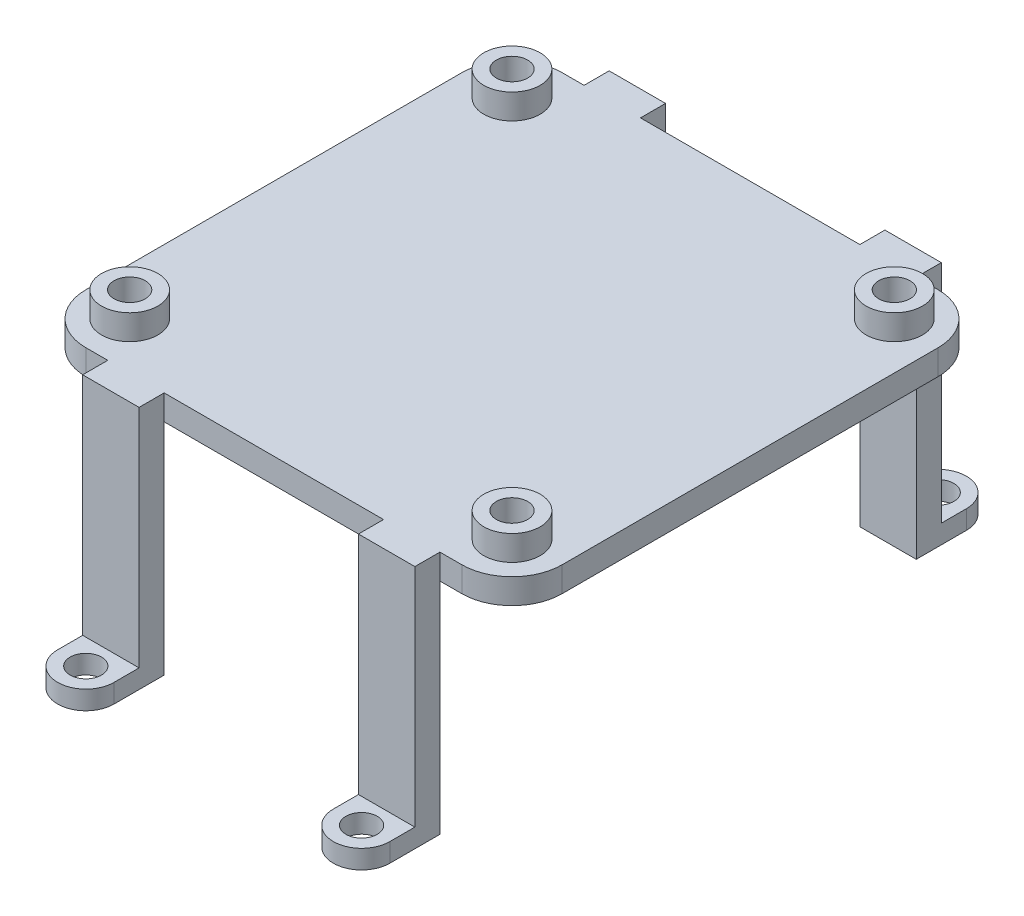
from build123d import *

# Parameters (mm, degrees)
SKETCH1_W                                  = 38
SKETCH1_H                                  = 38
BOSS_EXTRUDE1_DEPTH                        = 2
SKETCH2_R                                  = 2.25
BOSS_EXTRUDE2_DEPTH                        = 2
M3_TAPPED_HOLE1_D                          = 2.5
FILLET1_R                                  = 4
BOSS_EXTRUDE3_DEPTH                        = 1.5
SKETCH9_W                                  = 1.25
SKETCH9_H                                  = 1.5
SKETCH7_W                                  = 4.5
SKETCH7_H                                  = 2
BOSS_EXTRUDE4_DEPTH                        = 18
MIRROR1_AT_THE_SECOND_PLANE_COPY_1_SKETC_R = 2.25
MIRROR1_AT_THE_SECOND_PLANE_COPY_1_DEPTH   = 2
MIRROR1_AT_THE_SECOND_PLANE_COPY_2_D       = 2.5
MIRROR3_OUTLINE_W                          = 4.5
MIRROR3_OUTLINE_H                          = 2
MIRROR3_DEPTH                              = 19.5
MIRROR3_2_OUTLINE_R                        = 1.25
MIRROR3_2_DEPTH                            = 1.5


# Read off the part's stored shape, not the designer's step: Mirror3
with BuildPart() as part:
    # Sketch1 → Boss-Extrude1 (new body)
    with BuildSketch(Plane(origin=(0, 17.5, 0), x_dir=(1, 0, 0), z_dir=(0, 1, 0))):
        Rectangle(SKETCH1_W, SKETCH1_H)
    extrude(amount=BOSS_EXTRUDE1_DEPTH)

    # Sketch2 → Boss-Extrude2 (add)
    with BuildSketch(Plane(origin=(0, 19.5, 0), x_dir=(1, 0, 0), z_dir=(0, 1, 0))):
        with Locations(Location((15.25, 15.25, 0), (0, 0, 90))):
            Circle(SKETCH2_R)
    boss_extrude2 = extrude(amount=BOSS_EXTRUDE2_DEPTH)

    # M3 Tapped Hole1 (through all)
    with Locations(Plane(origin=(0, 21.5, 0), x_dir=(1, 0, 0), z_dir=(0, 1, 0))):
        with Locations((15.25, 15.25)):
            m3_tapped_hole1 = Hole(M3_TAPPED_HOLE1_D / 2)

    # Fillet1
    fillet1_edges = [part.edges().sort_by_distance(p)[0] for p in [
        (-19, 18.5, -19),
        (-19, 18.5, 19),
        (19, 18.5, 19),
        (19, 18.5, -19),
    ]]
    fillet(fillet1_edges, radius=FILLET1_R)



with BuildPart() as body_2:
    # Sketch6 → Boss-Extrude3 (new body)
    with BuildSketch(Plane(origin=(0, 0, 0), x_dir=(1, 0, 0), z_dir=(0, 1, 0))):
        with BuildLine():
            Line((13.25, 23), (13.25, 19))
            Line((13.25, 19), (8.75, 19))
            Line((8.75, 19), (8.75, 23))
            ThreePointArc((8.75, 23), (11, 25.25), (13.25, 23))
        make_face()
    extrude(amount=BOSS_EXTRUDE3_DEPTH)

    # Sketch9 → M3 Tapped Hole2 (revolve, cut)
    with BuildSketch(Plane(origin=(11, 1.5, -23), x_dir=(0, 0, 1), z_dir=(1, 0, 0))):
        with Locations((0.625, 0.75)):
            Rectangle(SKETCH9_W, SKETCH9_H)
    revolve(axis=Axis((11, 7.85, -23), (0, -1, 0)), mode=Mode.SUBTRACT)


with BuildPart() as part_1:
    add(part.part)

    add(body_2.part)  # Boss-Extrude4 merges body 2
    # Sketch7 → Boss-Extrude4 (add)
    with BuildSketch(Plane(origin=(0, 1.5, 0), x_dir=(1, 0, 0), z_dir=(0, 1, 0))):
        with Locations((11, 20)):
            Rectangle(SKETCH7_W, SKETCH7_H)
    extrude(amount=BOSS_EXTRUDE4_DEPTH)

    # Mirror1: Boss-Extrude2, M3 Tapped Hole1 across plane
    add(boss_extrude2.mirror(Plane(origin=(0, 0, 0), x_dir=(0, 0, 1), z_dir=(1, 0, 0))))
    add(m3_tapped_hole1.mirror(Plane(origin=(0, 0, 0), x_dir=(0, 0, 1), z_dir=(1, 0, 0))), mode=Mode.SUBTRACT)

    # Mirror1 at the second plane: Boss-Extrude2, M3 Tapped Hole1 across plane
    add(boss_extrude2.mirror(Plane.XY))
    add(m3_tapped_hole1.mirror(Plane.XY), mode=Mode.SUBTRACT)

    # Mirror1 at the second plane copy 1 sketc → Mirror1 at the second plane copy 1 (add)
    with BuildSketch(Plane(origin=(0, 19.5, 0), x_dir=(-1, 0, 0), z_dir=(0, 1, 0))):
        with Locations(Location((15.25, 15.25, 0), (0, 0, 90))):
            Circle(MIRROR1_AT_THE_SECOND_PLANE_COPY_1_SKETC_R)
    extrude(amount=MIRROR1_AT_THE_SECOND_PLANE_COPY_1_DEPTH)

    # Mirror1 at the second plane copy 2 (through all)
    with Locations(Plane(origin=(0, 21.5, 0), x_dir=(-1, 0, 0), z_dir=(0, 1, 0))):
        with Locations((15.25, 15.25)):
            Hole(MIRROR1_AT_THE_SECOND_PLANE_COPY_2_D / 2)

    # Mirror3 outline → Mirror3 (add)
    with BuildSketch(Plane(origin=(0, 0, 0), x_dir=(1, 0, 0), z_dir=(0, 1, 0))):
        with Locations((-11, -20)):
            Rectangle(MIRROR3_OUTLINE_W, MIRROR3_OUTLINE_H)
        with Locations((11, -20)):
            Rectangle(MIRROR3_OUTLINE_W, MIRROR3_OUTLINE_H)
        with Locations((-11, 20)):
            Rectangle(MIRROR3_OUTLINE_W, MIRROR3_OUTLINE_H)
    extrude(amount=MIRROR3_DEPTH)

    # Mirror3 2 outline → Mirror3 2 (add)
    # profile 1 of 3: a face of its own
    with BuildSketch(Plane(origin=(0, 0, 0), x_dir=(1, 0, 0), z_dir=(0, 1, 0))):
        with BuildLine():
            Line((13.25, -23), (13.25, -21))
            Line((13.25, -21), (8.75, -21))
            Line((8.75, -21), (8.75, -23))
            ThreePointArc((8.75, -23), (11, -25.25), (13.25, -23))
        make_face()
        with Locations((11, -23)):
            Circle(MIRROR3_2_OUTLINE_R, mode=Mode.SUBTRACT)
    # profile 2 of 3: a face of its own
    with BuildSketch(Plane(origin=(0, 0, 0), x_dir=(1, 0, 0), z_dir=(0, 1, 0))):
        with BuildLine():
            Line((-8.75, -23), (-8.75, -21))
            Line((-8.75, -21), (-13.25, -21))
            Line((-13.25, -21), (-13.25, -23))
            ThreePointArc((-13.25, -23), (-11, -25.25), (-8.75, -23))
        make_face()
        with Locations((-11, -23)):
            Circle(MIRROR3_2_OUTLINE_R, mode=Mode.SUBTRACT)
    # profile 3 of 3: a face of its own
    with BuildSketch(Plane(origin=(0, 0, 0), x_dir=(1, 0, 0), z_dir=(0, 1, 0))):
        with BuildLine():
            Line((-13.25, 21), (-8.75, 21))
            Line((-8.75, 21), (-8.75, 23))
            ThreePointArc((-8.75, 23), (-11, 25.25), (-13.25, 23))
            Line((-13.25, 23), (-13.25, 21))
        make_face()
        with Locations((-11, 23)):
            Circle(MIRROR3_2_OUTLINE_R, mode=Mode.SUBTRACT)
    extrude(amount=MIRROR3_2_DEPTH)


solid = part_1.part
